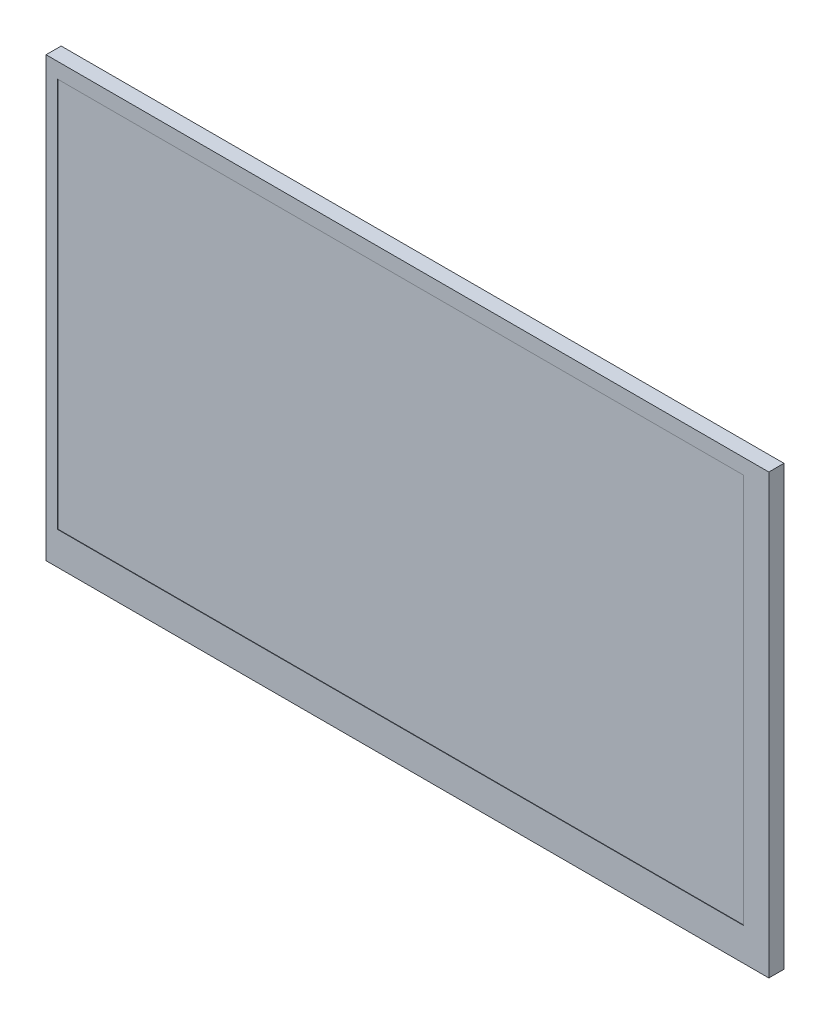
from build123d import *

# Parameters (mm, degrees)
ESQUISSE1_R             = 1.524
BOSS_EXTRU_1_DEPTH      = 2.1
ESQUISSE2_W             = 25.4
ESQUISSE2_H             = 25.4
BOSS_EXTRU_2_DEPTH      = 2.3
ESQUISSE3_W             = 164.95
ESQUISSE3_H             = 100
BOSS_EXTRU_3_DEPTH      = 3.45
ESQUISSE4_W             = 156.5
ESQUISSE4_H             = 89
ENL_V_MAT_EXTRU_1_DEPTH = 0.1
ESQUISSE5_W             = 29.8
ESQUISSE5_H             = 7.4
ENL_V_MAT_EXTRU_2_DEPTH = 2.1
CONG_1_R                = 1
ESQUISSE6_W             = 26.5
ESQUISSE6_H             = 5.4
BOSS_EXTRU_4_DEPTH      = 2
ESQUISSE7_W             = 11.59
ESQUISSE7_H             = 15
BOSS_EXTRU_5_DEPTH      = 6.16
ESQUISSE8_W             = 5.5
ESQUISSE8_H             = 7.88
BOSS_EXTRU_6_DEPTH      = 2.8
ESQUISSE9_W             = 13.84
ESQUISSE9_H             = 13.84
BOSS_EXTRU_7_DEPTH      = 1
BOSS_EXTRU_8_DEPTH      = 0.1
BOSS_EXTRU_8_DEPTH_BACK = 2.11
ESQUISSE10_R            = 3.175
ESQUISSE10_R_2          = 1.524


with BuildPart() as part:
    # Esquisse1 → Boss.-Extru.1 (new body)
    with BuildSketch(Plane.XY):
        with BuildLine():
            Line((-82.615, 53.25), (-82.615, -53.25))
            ThreePointArc((-82.615, -53.25), (-78.613, -57.252), (-74.611, -53.25))
            Line((-74.611, -53.25), (-74.611, -50.036793886))
            Line((-74.611, -50.036793886), (74.611, -50.036793886))
            Line((74.611, -50.036793886), (74.611, -53.25))
            ThreePointArc((74.611, -53.25), (78.613, -57.252), (82.615, -53.25))
            Line((82.615, -53.25), (82.615, 53.25))
            ThreePointArc((82.615, 53.25), (78.613, 57.252), (74.611, 53.25))
            Line((74.611, 53.25), (74.611, 50.036793886))
            Line((74.611, 50.036793886), (-74.611, 50.036793886))
            Line((-74.611, 50.036793886), (-74.611, 53.25))
            ThreePointArc((-74.611, 53.25), (-78.613, 57.252), (-82.615, 53.25))
        make_face()
        with Locations((-78.613, 53.25)):
            Circle(ESQUISSE1_R, mode=Mode.SUBTRACT)
        with Locations((-78.613, -53.25)):
            Circle(ESQUISSE1_R, mode=Mode.SUBTRACT)
        with Locations((78.613, -53.25)):
            Circle(ESQUISSE1_R, mode=Mode.SUBTRACT)
        with Locations((78.613, 53.25)):
            Circle(ESQUISSE1_R, mode=Mode.SUBTRACT)
    extrude(amount=BOSS_EXTRU_1_DEPTH)

    # Esquisse2 → Boss.-Extru.2 (add)
    with BuildSketch(Plane.XY.offset(2.1)):
        with Locations((-61.8, 27.3)):
            Rectangle(ESQUISSE2_W, ESQUISSE2_H)
        with Locations((-61.8, -27.3)):
            Rectangle(ESQUISSE2_W, ESQUISSE2_H)
        with Locations((61.8, 27.3)):
            Rectangle(ESQUISSE2_W, ESQUISSE2_H)
        with Locations((61.8, -27.3)):
            Rectangle(ESQUISSE2_W, ESQUISSE2_H)
    extrude(amount=BOSS_EXTRU_2_DEPTH)

    # Esquisse3 → Boss.-Extru.3 (add)
    with BuildSketch(Plane.XY.offset(4.4)):
        Rectangle(ESQUISSE3_W, ESQUISSE3_H)
    extrude(amount=BOSS_EXTRU_3_DEPTH)

    # Esquisse4 → Enlèv. mat.-Extru.1 (cut)
    with BuildSketch(Plane.XY.offset(7.85)):
        with Locations((-1.605, 2)):
            Rectangle(ESQUISSE4_W, ESQUISSE4_H)
    extrude(amount=-ENL_V_MAT_EXTRU_1_DEPTH, mode=Mode.SUBTRACT)

    # Esquisse5 → Enlèv. mat.-Extru.2 (cut)
    with BuildSketch(Plane(origin=(0, 0, 0), x_dir=(-1, 0, 0), z_dir=(0, 0, -1))):
        with Locations((38.315, -0.136793886)):
            Rectangle(ESQUISSE5_W, ESQUISSE5_H)
    extrude(amount=-ENL_V_MAT_EXTRU_2_DEPTH, mode=Mode.SUBTRACT)

    # Congé1
    cong_1_edges = [part.edges().sort_by_distance(p)[0] for p in [
        (-23.415, 3.563206114, 1.05),
        (-23.415, -3.836793886, 1.05),
        (-53.215, -3.836793886, 1.05),
        (-53.215, 3.563206114, 1.05),
    ]]
    fillet(cong_1_edges, radius=CONG_1_R)

    # Esquisse6 → Boss.-Extru.4 (add)
    with BuildSketch(Plane(origin=(0, 0, 0), x_dir=(-1, 0, 0), z_dir=(0, 0, -1))):
        with Locations((38.315, 6.363206114)):
            Rectangle(ESQUISSE6_W, ESQUISSE6_H)
    extrude(amount=BOSS_EXTRU_4_DEPTH)

    # Esquisse7 → Boss.-Extru.5 (add)
    with BuildSketch(Plane(origin=(0, 0, 0), x_dir=(-1, 0, 0), z_dir=(0, 0, -1))):
        with Locations((-79.02, 1.017206114)):
            Rectangle(ESQUISSE7_W, ESQUISSE7_H)
    extrude(amount=BOSS_EXTRU_5_DEPTH)

    # Esquisse8 → Boss.-Extru.6 (add)
    with BuildSketch(Plane(origin=(0, 0, 0), x_dir=(-1, 0, 0), z_dir=(0, 0, -1))):
        with Locations((-80.665, -20.318793886)):
            Rectangle(ESQUISSE8_W, ESQUISSE8_H)
    extrude(amount=BOSS_EXTRU_6_DEPTH)

    # Esquisse9 → Boss.-Extru.7 (add)
    with BuildSketch(Plane(origin=(0, 0, 0), x_dir=(-1, 0, 0), z_dir=(0, 0, -1))):
        with Locations((-52.695, 0.616793886)):
            Rectangle(ESQUISSE9_W, ESQUISSE9_H)
    extrude(amount=BOSS_EXTRU_7_DEPTH)

    # Esquisse10 → Boss.-Extru.8 (add, two sides: drawn at the far end of the back side and taken through both)
    # profile 1 of 4: a face of its own
    with BuildSketch(Plane.XY.offset(2.1).offset(-BOSS_EXTRU_8_DEPTH_BACK)):
        with Locations((-78.613, 53.25)):
            Circle(ESQUISSE10_R)
        with Locations((-78.613, 53.25)):
            Circle(ESQUISSE10_R_2, mode=Mode.SUBTRACT)
    # profile 2 of 4: a face of its own
    with BuildSketch(Plane.XY.offset(2.1).offset(-BOSS_EXTRU_8_DEPTH_BACK)):
        with Locations((-78.613, -53.25)):
            Circle(ESQUISSE10_R)
        with Locations((-78.613, -53.25)):
            Circle(ESQUISSE10_R_2, mode=Mode.SUBTRACT)
    # profile 3 of 4: a face of its own
    with BuildSketch(Plane.XY.offset(2.1).offset(-BOSS_EXTRU_8_DEPTH_BACK)):
        with Locations((78.613, -53.25)):
            Circle(ESQUISSE10_R)
        with Locations((78.613, -53.25)):
            Circle(ESQUISSE10_R_2, mode=Mode.SUBTRACT)
    # profile 4 of 4: a face of its own
    with BuildSketch(Plane.XY.offset(2.1).offset(-BOSS_EXTRU_8_DEPTH_BACK)):
        with Locations((78.613, 53.25)):
            Circle(ESQUISSE10_R)
        with Locations((78.613, 53.25)):
            Circle(ESQUISSE10_R_2, mode=Mode.SUBTRACT)
    extrude(amount=BOSS_EXTRU_8_DEPTH + BOSS_EXTRU_8_DEPTH_BACK)

    # Split1
    split(bisect_by=Plane.XY.offset(4.4), keep=Keep.TOP)


solid = part.part
